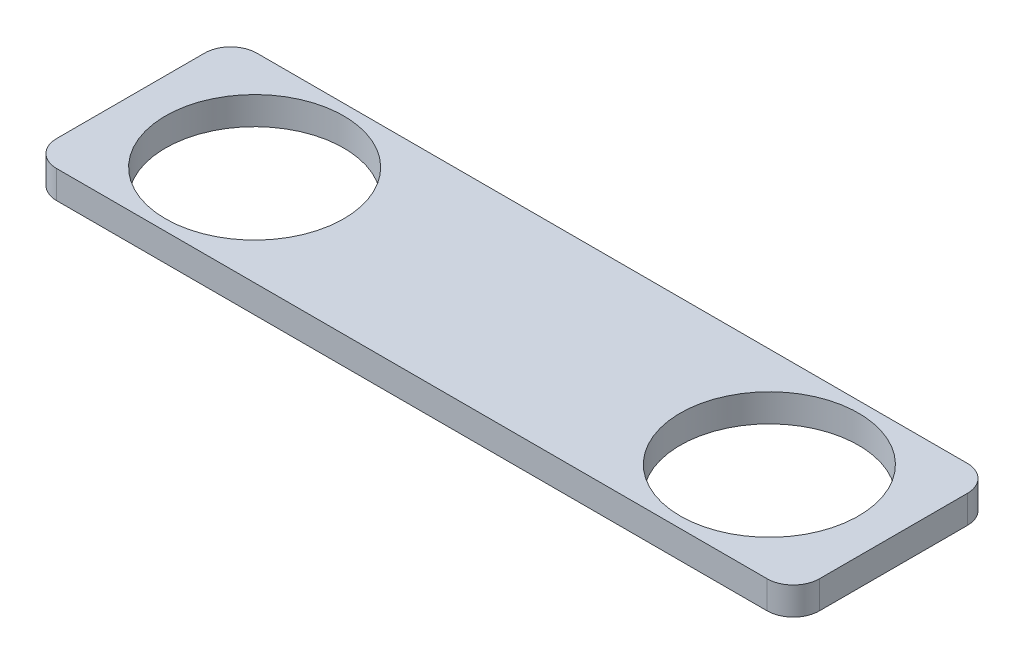
from build123d import *

# Parameters (mm, degrees)
SKETCH1_W           = 87.682
SKETCH1_H           = 23
SKETCH1_R           = 10.25
BOSS_EXTRUDE1_DEPTH = 3.2
FILLET1_R           = 3


with BuildPart() as part:
    # Sketch1 → Boss-Extrude1 (new body)
    with BuildSketch(Plane(origin=(0, 0, 0), x_dir=(1, 0, 0), z_dir=(0, 1, 0))):
        Rectangle(SKETCH1_W, SKETCH1_H)
        with Locations(Location((29.591, 0, 0), (0, 0, 270))):
            Circle(SKETCH1_R, mode=Mode.SUBTRACT)
        with Locations(Location((-29.591, 0, 0), (0, 0, 270))):
            Circle(SKETCH1_R, mode=Mode.SUBTRACT)
    extrude(amount=BOSS_EXTRUDE1_DEPTH)

    # Fillet1
    fillet1_edges = [part.edges().sort_by_distance(p)[0] for p in [
        (43.841, 1.6, -11.5),
        (43.841, 1.6, 11.5),
        (-43.841, 1.6, 11.5),
        (-43.841, 1.6, -11.5),
    ]]
    fillet(fillet1_edges, radius=FILLET1_R)


solid = part.part
